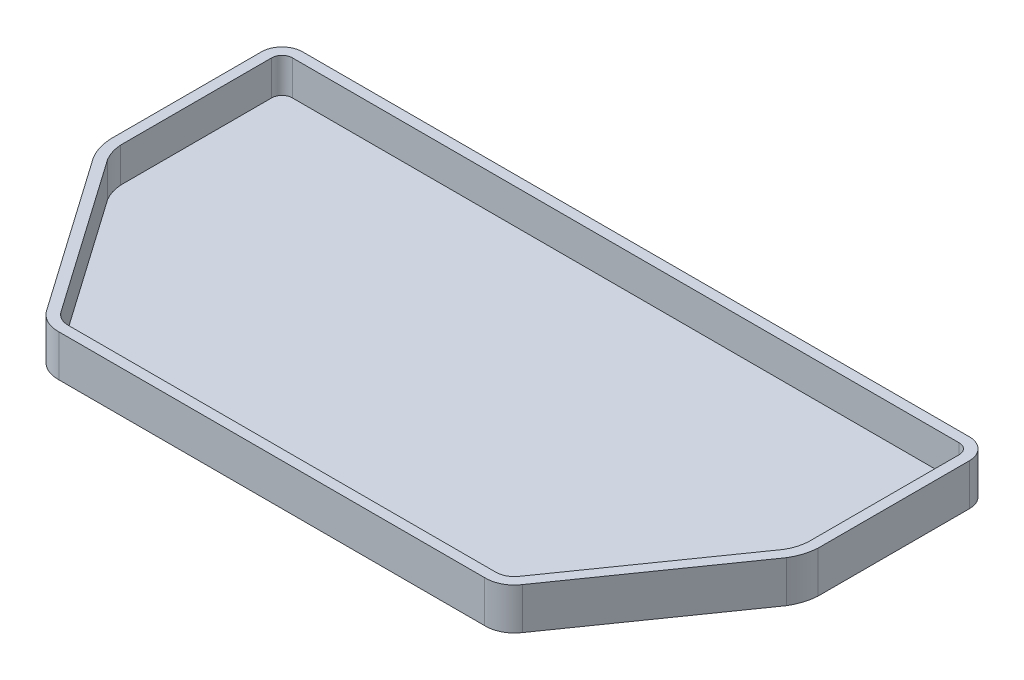
from build123d import *

# Parameters (mm, degrees)
EXTRUDE_1_DEPTH = 2
EXTRUDE_START   = 10.1
EXTRUDE_2_DEPTH = 10.1


with BuildPart() as part:
    # 草图1 → 凸台-拉伸1 (new body)
    with BuildSketch(Plane(origin=(0, 0, 0), x_dir=(1, 0, 0), z_dir=(0, 1, 0))):
        with BuildLine():
            Line((197, 3), (3, 3))
            ThreePointArc((3, 3), (-1.242640687, 1.242640687), (-3, -3))
            Line((-3, -3), (-3, -47.100513143))
            ThreePointArc((-3, -47.100513143), (-2.32247943, -50.732097147), (-0.794949231, -54.09573922))
            Line((-0.794949231, -54.09573922), (30.796891429, -99.226940163))
            ThreePointArc((30.796891429, -99.226940163), (33.932268231, -102.05074496), (38.04363979, -103))
            Line((38.04363979, -103), (161.95636021, -103))
            ThreePointArc((161.95636021, -103), (166.067731769, -102.05074496), (169.203108571, -99.226940163))
            Line((169.203108571, -99.226940163), (200.794949231, -54.09573922))
            ThreePointArc((200.794949231, -54.09573922), (202.32247943, -50.732097147), (203, -47.100513143))
            Line((203, -47.100513143), (203, -3))
            ThreePointArc((203, -3), (201.242640687, 1.242640687), (197, 3))
        make_face()
    extrude(amount=-EXTRUDE_1_DEPTH)

    # 草图1<3> → 凸台-拉伸2 (add)
    with BuildSketch(Plane(origin=(0, 0, 0), x_dir=(1, 0, 0), z_dir=(0, 1, 0)).offset(EXTRUDE_START)):
        with BuildLine():
            Line((197, 3), (3, 3))
            ThreePointArc((3, 3), (-1.242640687, 1.242640687), (-3, -3))
            Line((-3, -3), (-3, -47.100513143))
            ThreePointArc((-3, -47.100513143), (-2.32247943, -50.732097147), (-0.794949231, -54.09573922))
            Line((-0.794949231, -54.09573922), (30.796891429, -99.226940163))
            ThreePointArc((30.796891429, -99.226940163), (33.932268231, -102.05074496), (38.04363979, -103))
            Line((38.04363979, -103), (161.95636021, -103))
            ThreePointArc((161.95636021, -103), (166.067731769, -102.05074496), (169.203108571, -99.226940163))
            Line((169.203108571, -99.226940163), (200.794949231, -54.09573922))
            ThreePointArc((200.794949231, -54.09573922), (202.32247943, -50.732097147), (203, -47.100513143))
            Line((203, -47.100513143), (203, -3))
            ThreePointArc((203, -3), (201.242640687, 1.242640687), (197, 3))
        make_face()
        with BuildLine():
            Line((0, -3), (0, -47))
            ThreePointArc((0, -47), (0.538734236, -49.830178992), (1.720387033, -52.457695762))
            Line((1.720387033, -52.457695762), (33.279612967, -97.542304238))
            ThreePointArc((33.279612967, -97.542304238), (35.317699373, -99.389808931), (38, -100))
            Line((38, -100), (162, -100))
            ThreePointArc((162, -100), (164.682300627, -99.389808931), (166.720387033, -97.542304238))
            Line((166.720387033, -97.542304238), (198.279612967, -52.457695762))
            ThreePointArc((198.279612967, -52.457695762), (199.461265764, -49.830178992), (200, -47))
            Line((200, -47), (200, -3))
            ThreePointArc((200, -3), (199.121320344, -0.878679656), (197, 0))
            Line((197, 0), (3, 0))
            ThreePointArc((3, 0), (0.878679656, -0.878679656), (0, -3))
        make_face(mode=Mode.SUBTRACT)
    extrude(amount=-EXTRUDE_2_DEPTH)


solid = part.part
